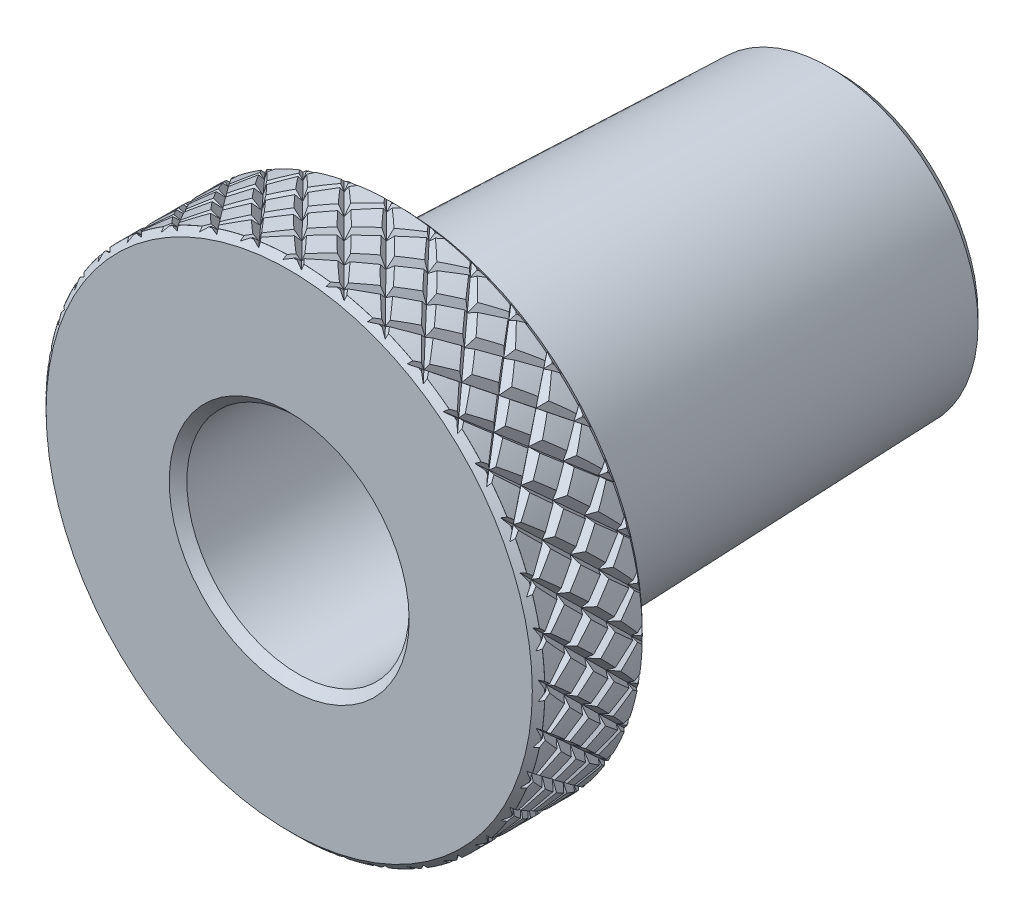
from build123d import *
from OCP.BRepFilletAPI import BRepFilletAPI_MakeChamfer

# Parameters (mm, degrees)
SKETCH1_R           = 4.282439997
BOSS_EXTRUDE1_DEPTH = 12.7
BOSS_EXTRUDE1_DRAFT = -2
SKETCH2_R           = 7.20725
BOSS_EXTRUDE2_DEPTH = 3.175
FILLET1_R           = 1.5875
SKETCH3_R           = 3.2131
CUT_EXTRUDE1_DEPTH  = 143.492079684
CIRPATTERN1_COUNT   = 36
CHAMFER2_SIZE       = 0.254
CHAMFER2_SIZE2      = 0.263351253


with BuildPart() as part:
    # Sketch1 → Boss-Extrude1 (with draft: the straight prism first)
    with BuildSketch(Plane.XY):
        with Locations((-72.0725, 110.124324555)):
            Circle(SKETCH1_R)
    extrude(amount=BOSS_EXTRUDE1_DEPTH)
    # Boss-Extrude1: the draft: its side faces are tilted about the plane it starts from
    boss_extrude1_sides = [part.faces().sort_by_distance(p)[0] for p in [
        (-76.354939997, 110.124324555, 6.35),
    ]]
    draft(boss_extrude1_sides, Plane.XY, BOSS_EXTRUDE1_DRAFT)

    # Sketch2 → Boss-Extrude2 (add)
    with BuildSketch(Plane.XY.offset(12.7)):
        with Locations((-72.0725, 110.124324555)):
            Circle(SKETCH2_R)
    extrude(amount=BOSS_EXTRUDE2_DEPTH)

    # Fillet1
    fillet1_edges = [part.edges().sort_by_distance(p)[0] for p in [
        (-76.798433769, 110.124324555, 12.7),
    ]]
    fillet(fillet1_edges, radius=FILLET1_R)

    # Sketch3 → Cut-Extrude1 (cut, through all)
    with BuildSketch(Plane.XY.offset(15.875)):
        with Locations((-72.0725, 110.124324555)):
            Circle(SKETCH3_R)
    extrude(amount=-CUT_EXTRUDE1_DEPTH, mode=Mode.SUBTRACT)

    # Cut-Sweep2: sweep along a path in Sketch4
    with BuildLine(Plane(origin=(-79.27975, 0, 0), x_dir=(0, 0, -1), z_dir=(1, 0, 0))) as cut_sweep2_path:
        Line((-17.387062992, 113.223887547), (-11.187937008, 107.024761563))
    # Sketch7 → Cut-Sweep2 (sweep, cut)
    with BuildSketch(Plane(origin=(-79.27975, 113.223887547, 17.387062992), x_dir=(-1, 0, 0), z_dir=(0, -0.7071067811865454, -0.7071067811865498))):
        Polygon((-0.254, 0), (0, -0.146646968), (0, 0.146646968), align=None)
    cut_sweep2 = sweep(path=cut_sweep2_path.line, mode=Mode.SUBTRACT)

    # CirPattern1: Cut-Sweep2 ×36 about axis
    cirpattern1_axis = Axis((-72.0725, 110.124324555, 15.875), (0, 0, -1))
    for i in range(1, CIRPATTERN1_COUNT):
        add(cut_sweep2.rotate(cirpattern1_axis, i * 360 / CIRPATTERN1_COUNT), mode=Mode.SUBTRACT)

    # Mirror1 copy 1: sweep along a path in Mirror1 copy 1 path
    with BuildLine(Plane(origin=(-45.851856046, 2.924561766, 0), x_dir=(0, 0, -1), z_dir=(-0.984807753012208, -0.17364817766693033, 0))) as mirror1_copy_1_path:
        Line((-17.387062992, -113.223887547), (-11.187937008, -107.024761563))
    # Mirror1 copy 1 sketch → Mirror1 copy 1 (sweep, cut)
    with BuildSketch(Plane(origin=(-65.512977787, 114.428324049, 17.387062992), x_dir=(0.984807753012208, 0.17364817766693033, 0), z_dir=(0.12278780396897246, -0.6963642403200168, -0.7071067811865498))):
        Polygon((-0.254, 0), (0, 0.146646968), (0, -0.146646968), align=None)
    sweep(path=mirror1_copy_1_path.line, mode=Mode.SUBTRACT)

    # Mirror1 copy 2: sweep along a path in Mirror1 copy 2 path
    with BuildLine(Plane(origin=(-27.635163091, 9.10633408, 0), x_dir=(0, 0, -1), z_dir=(-0.9396926207859084, -0.3420201433256687, 0))) as mirror1_copy_2_path:
        Line((-17.387062992, -113.223887547), (-11.187937008, -107.024761563))
    # Mirror1 copy 2 sketch → Mirror1 copy 2 (sweep, cut)
    with BuildSketch(Plane(origin=(-66.360013338, 115.501985704, 17.387062992), x_dir=(0.9396926207859084, 0.3420201433256687, 0), z_dir=(0.2418447626479745, -0.6644630243886727, -0.7071067811865498))):
        Polygon((-0.254, 0), (0, 0.146646968), (0, -0.146646968), align=None)
    sweep(path=mirror1_copy_2_path.line, mode=Mode.SUBTRACT)

    # Mirror1 copy 3: sweep along a path in Mirror1 copy 3 path
    with BuildLine(Plane(origin=(-10.768676131, 18.357486916, 0), x_dir=(0, 0, -1), z_dir=(-0.8660254037844387, -0.49999999999999994, 0))) as mirror1_copy_3_path:
        Line((-17.387062992, -113.223887547), (-11.187937008, -107.024761563))
    # Mirror1 copy 3 sketch → Mirror1 copy 3 (sweep, cut)
    with BuildSketch(Plane(origin=(-67.380619905, 116.412249847, 17.387062992), x_dir=(0.8660254037844387, 0.49999999999999994, 0), z_dir=(0.3535533905932726, -0.6123724356957927, -0.7071067811865498))):
        Polygon((-0.254, 0), (0, 0.146646968), (0, -0.146646968), align=None)
    sweep(path=mirror1_copy_3_path.line, mode=Mode.SUBTRACT)

    # Mirror1 copy 4: sweep along a path in Mirror1 copy 4 path
    with BuildLine(Plane(origin=(4.235125162, 30.396928677, 0), x_dir=(0, 0, -1), z_dir=(-0.766044443118978, -0.6427876096865393, 0))) as mirror1_copy_4_path:
        Line((-17.387062992, -113.223887547), (-11.187937008, -107.024761563))
    # Mirror1 copy 4 sketch → Mirror1 copy 4 (sweep, cut)
    with BuildSketch(Plane(origin=(-68.543786874, 117.131458561, 17.387062992), x_dir=(0.766044443118978, 0.6427876096865393, 0), z_dir=(0.4545194776720422, -0.5416752204197002, -0.7071067811865498))):
        Polygon((-0.254, 0), (0, 0.146646968), (0, -0.146646968), align=None)
    sweep(path=mirror1_copy_4_path.line, mode=Mode.SUBTRACT)

    # Mirror1 copy 5: sweep along a path in Mirror1 copy 5 path
    with BuildLine(Plane(origin=(16.920357878, 44.858847019, 0), x_dir=(0, 0, -1), z_dir=(-0.6427876096865394, -0.766044443118978, 0))) as mirror1_copy_5_path:
        Line((-17.387062992, -113.223887547), (-11.187937008, -107.024761563))
    # Mirror1 copy 5 sketch → Mirror1 copy 5 (sweep, cut)
    with BuildSketch(Plane(origin=(-69.814172006, 117.637759054, 17.387062992), x_dir=(0.6427876096865394, 0.766044443118978, 0), z_dir=(0.5416752204197002, -0.4545194776720423, -0.7071067811865498))):
        Polygon((-0.254, 0), (0, 0.146646968), (0, -0.146646968), align=None)
    sweep(path=mirror1_copy_5_path.line, mode=Mode.SUBTRACT)

    # Mirror1 copy 6: sweep along a path in Mirror1 copy 6 path
    with BuildLine(Plane(origin=(26.901587639, 61.303823869, 0), x_dir=(0, 0, -1), z_dir=(-0.5000000000000001, -0.8660254037844386, 0))) as mirror1_copy_6_path:
        Line((-17.387062992, -113.223887547), (-11.187937008, -107.024761563))
    # Mirror1 copy 6 sketch → Mirror1 copy 6 (sweep, cut)
    with BuildSketch(Plane(origin=(-71.153175292, 117.915767642, 17.387062992), x_dir=(0.5000000000000001, 0.8660254037844386, 0), z_dir=(0.6123724356957926, -0.35355339059327273, -0.7071067811865498))):
        Polygon((-0.254, 0), (0, 0.146646968), (0, -0.146646968), align=None)
    sweep(path=mirror1_copy_6_path.line, mode=Mode.SUBTRACT)

    # Mirror1 copy 7: sweep along a path in Mirror1 copy 7 path
    with BuildLine(Plane(origin=(33.875539831, 79.232186928, 0), x_dir=(0, 0, -1), z_dir=(-0.3420201433256688, -0.9396926207859083, 0))) as mirror1_copy_7_path:
        Line((-17.387062992, -113.223887547), (-11.187937008, -107.024761563))
    # Mirror1 copy 7 sketch → Mirror1 copy 7 (sweep, cut)
    with BuildSketch(Plane(origin=(-72.520111793, 117.957037175, 17.387062992), x_dir=(0.3420201433256688, 0.9396926207859083, 0), z_dir=(0.6644630243886727, -0.24184476264797458, -0.7071067811865498))):
        Polygon((-0.254, 0), (0, 0.146646968), (0, -0.146646968), align=None)
    sweep(path=mirror1_copy_7_path.line, mode=Mode.SUBTRACT)

    # Mirror1 copy 8: sweep along a path in Mirror1 copy 8 path
    with BuildLine(Plane(origin=(37.630314446, 98.099191957, 0), x_dir=(0, 0, -1), z_dir=(-0.17364817766693041, -0.984807753012208, 0))) as mirror1_copy_8_path:
        Line((-17.387062992, -113.223887547), (-11.187937008, -107.024761563))
    # Mirror1 copy 8 sketch → Mirror1 copy 8 (sweep, cut)
    with BuildSketch(Plane(origin=(-73.873447837, 117.760313698, 17.387062992), x_dir=(0.17364817766693041, 0.984807753012208, 0), z_dir=(0.6963642403200168, -0.12278780396897251, -0.7071067811865498))):
        Polygon((-0.254, 0), (0, 0.146646968), (0, -0.146646968), align=None)
    sweep(path=mirror1_copy_8_path.line, mode=Mode.SUBTRACT)

    # Mirror1 copy 9: sweep along a path in Mirror1 copy 9 path
    with BuildLine(Plane(origin=(38.051824555, 117.331574555, 0), x_dir=(0, 0, -1), z_dir=(0, -1, 0))) as mirror1_copy_9_path:
        Line((-17.387062992, -113.223887547), (-11.187937008, -107.024761563))
    # Mirror1 copy 9 sketch → Mirror1 copy 9 (sweep, cut)
    with BuildSketch(Plane(origin=(-75.172062992, 117.331574555, 17.387062992), x_dir=(0, 1, 0), z_dir=(0.7071067811865454, 0, -0.7071067811865498))):
        Polygon((-0.254, 0), (0, 0.146646968), (0, -0.146646968), align=None)
    sweep(path=mirror1_copy_9_path.line, mode=Mode.SUBTRACT)

    # Mirror1 copy 10: sweep along a path in Mirror1 copy 10 path
    with BuildLine(Plane(origin=(35.127262789, 136.344968509, 0), x_dir=(0, 0, -1), z_dir=(0.1736481776669303, -0.984807753012208, 0))) as mirror1_copy_10_path:
        Line((-17.387062992, -113.223887547), (-11.187937008, -107.024761563))
    # Mirror1 copy 10 sketch → Mirror1 copy 10 (sweep, cut)
    with BuildSketch(Plane(origin=(-76.376499494, 116.683846768, 17.387062992), x_dir=(-0.1736481776669303, 0.984807753012208, 0), z_dir=(0.6963642403200168, 0.12278780396897243, -0.7071067811865498))):
        Polygon((-0.254, 0), (0, 0.146646968), (0, -0.146646968), align=None)
    sweep(path=mirror1_copy_10_path.line, mode=Mode.SUBTRACT)

    # Mirror1 copy 11: sweep along a path in Mirror1 copy 11 path
    with BuildLine(Plane(origin=(28.945490475, 154.561661464, 0), x_dir=(0, 0, -1), z_dir=(0.3420201433256687, -0.9396926207859084, 0))) as mirror1_copy_11_path:
        Line((-17.387062992, -113.223887547), (-11.187937008, -107.024761563))
    # Mirror1 copy 11 sketch → Mirror1 copy 11 (sweep, cut)
    with BuildSketch(Plane(origin=(-77.450161149, 115.836811217, 17.387062992), x_dir=(-0.3420201433256687, 0.9396926207859084, 0), z_dir=(0.6644630243886727, 0.2418447626479745, -0.7071067811865498))):
        Polygon((-0.254, 0), (0, 0.146646968), (0, -0.146646968), align=None)
    sweep(path=mirror1_copy_11_path.line, mode=Mode.SUBTRACT)

    # Mirror1 copy 12: sweep along a path in Mirror1 copy 12 path
    with BuildLine(Plane(origin=(19.694337639, 171.428148424, 0), x_dir=(0, 0, -1), z_dir=(0.4999999999999998, -0.8660254037844387, 0))) as mirror1_copy_12_path:
        Line((-17.387062992, -113.223887547), (-11.187937008, -107.024761563))
    # Mirror1 copy 12 sketch → Mirror1 copy 12 (sweep, cut)
    with BuildSketch(Plane(origin=(-78.360425292, 114.816204651, 17.387062992), x_dir=(-0.4999999999999998, 0.8660254037844387, 0), z_dir=(0.6123724356957927, 0.3535533905932725, -0.7071067811865498))):
        Polygon((-0.254, 0), (0, 0.146646968), (0, -0.146646968), align=None)
    sweep(path=mirror1_copy_12_path.line, mode=Mode.SUBTRACT)

    # Mirror1 copy 13: sweep along a path in Mirror1 copy 13 path
    with BuildLine(Plane(origin=(7.654895878, 186.431949717, 0), x_dir=(0, 0, -1), z_dir=(0.6427876096865394, -0.766044443118978, 0))) as mirror1_copy_13_path:
        Line((-17.387062992, -113.223887547), (-11.187937008, -107.024761563))
    # Mirror1 copy 13 sketch → Mirror1 copy 13 (sweep, cut)
    with BuildSketch(Plane(origin=(-79.079634006, 113.653037681, 17.387062992), x_dir=(-0.6427876096865394, 0.766044443118978, 0), z_dir=(0.5416752204197002, 0.4545194776720423, -0.7071067811865497))):
        Polygon((-0.254, 0), (0, 0.146646968), (0, -0.146646968), align=None)
    sweep(path=mirror1_copy_13_path.line, mode=Mode.SUBTRACT)

    # Mirror1 copy 14: sweep along a path in Mirror1 copy 14 path
    with BuildLine(Plane(origin=(-6.807022464, 199.117182433, 0), x_dir=(0, 0, -1), z_dir=(0.7660444431189779, -0.6427876096865395, 0))) as mirror1_copy_14_path:
        Line((-17.387062992, -113.223887547), (-11.187937008, -107.024761563))
    # Mirror1 copy 14 sketch → Mirror1 copy 14 (sweep, cut)
    with BuildSketch(Plane(origin=(-79.585934499, 112.382652549, 17.387062992), x_dir=(-0.7660444431189779, 0.6427876096865395, 0), z_dir=(0.45451947767204237, 0.5416752204197001, -0.7071067811865498))):
        Polygon((-0.254, 0), (0, 0.146646968), (0, -0.146646968), align=None)
    sweep(path=mirror1_copy_14_path.line, mode=Mode.SUBTRACT)

    # Mirror1 copy 15: sweep along a path in Mirror1 copy 15 path
    with BuildLine(Plane(origin=(-23.251999314, 209.098412194, 0), x_dir=(0, 0, -1), z_dir=(0.8660254037844387, -0.49999999999999994, 0))) as mirror1_copy_15_path:
        Line((-17.387062992, -113.223887547), (-11.187937008, -107.024761563))
    # Mirror1 copy 15 sketch → Mirror1 copy 15 (sweep, cut)
    with BuildSketch(Plane(origin=(-79.863943087, 111.043649263, 17.387062992), x_dir=(-0.8660254037844387, 0.49999999999999994, 0), z_dir=(0.3535533905932726, 0.6123724356957927, -0.7071067811865498))):
        Polygon((-0.254, 0), (0, 0.146646968), (0, -0.146646968), align=None)
    sweep(path=mirror1_copy_15_path.line, mode=Mode.SUBTRACT)

    # Mirror1 copy 16: sweep along a path in Mirror1 copy 16 path
    with BuildLine(Plane(origin=(-41.180362373, 216.072364386, 0), x_dir=(0, 0, -1), z_dir=(0.9396926207859083, -0.3420201433256689, 0))) as mirror1_copy_16_path:
        Line((-17.387062992, -113.223887547), (-11.187937008, -107.024761563))
    # Mirror1 copy 16 sketch → Mirror1 copy 16 (sweep, cut)
    with BuildSketch(Plane(origin=(-79.90521262, 109.676712762, 17.387062992), x_dir=(-0.9396926207859083, 0.3420201433256689, 0), z_dir=(0.24184476264797464, 0.6644630243886727, -0.7071067811865498))):
        Polygon((-0.254, 0), (0, 0.146646968), (0, -0.146646968), align=None)
    sweep(path=mirror1_copy_16_path.line, mode=Mode.SUBTRACT)

    # Mirror1 copy 17: sweep along a path in Mirror1 copy 17 path
    with BuildLine(Plane(origin=(-60.047367402, 219.827139001, 0), x_dir=(0, 0, -1), z_dir=(0.984807753012208, -0.17364817766693028, 0))) as mirror1_copy_17_path:
        Line((-17.387062992, -113.223887547), (-11.187937008, -107.024761563))
    # Mirror1 copy 17 sketch → Mirror1 copy 17 (sweep, cut)
    with BuildSketch(Plane(origin=(-79.708489143, 108.323376718, 17.387062992), x_dir=(-0.984807753012208, 0.17364817766693028, 0), z_dir=(0.12278780396897242, 0.6963642403200168, -0.7071067811865498))):
        Polygon((-0.254, 0), (0, 0.146646968), (0, -0.146646968), align=None)
    sweep(path=mirror1_copy_17_path.line, mode=Mode.SUBTRACT)

    # Mirror1 copy 18: sweep along a path in Mirror1 copy 18 path
    with BuildLine(Plane(origin=(-79.27975, 220.24864911, 0), x_dir=(0, 0, -1), z_dir=(1, 0, 0))) as mirror1_copy_18_path:
        Line((-17.387062992, -113.223887547), (-11.187937008, -107.024761563))
    # Mirror1 copy 18 sketch → Mirror1 copy 18 (sweep, cut)
    with BuildSketch(Plane(origin=(-79.27975, 107.024761563, 17.387062992), x_dir=(-1, 0, 0), z_dir=(0, 0.7071067811865454, -0.7071067811865498))):
        Polygon((-0.254, 0), (0, 0.146646968), (0, -0.146646968), align=None)
    sweep(path=mirror1_copy_18_path.line, mode=Mode.SUBTRACT)

    # Mirror1 copy 19: sweep along a path in Mirror1 copy 19 path
    with BuildLine(Plane(origin=(-98.293143954, 217.324087344, 0), x_dir=(0, 0, -1), z_dir=(0.984807753012208, 0.17364817766693047, 0))) as mirror1_copy_19_path:
        Line((-17.387062992, -113.223887547), (-11.187937008, -107.024761563))
    # Mirror1 copy 19 sketch → Mirror1 copy 19 (sweep, cut)
    with BuildSketch(Plane(origin=(-78.632022213, 105.820325061, 17.387062992), x_dir=(-0.984807753012208, -0.17364817766693047, 0), z_dir=(-0.12278780396897256, 0.6963642403200168, -0.7071067811865498))):
        Polygon((-0.254, 0), (0, 0.146646968), (0, -0.146646968), align=None)
    sweep(path=mirror1_copy_19_path.line, mode=Mode.SUBTRACT)

    # Mirror1 copy 20: sweep along a path in Mirror1 copy 20 path
    with BuildLine(Plane(origin=(-116.509836909, 211.14231503, 0), x_dir=(0, 0, -1), z_dir=(0.9396926207859084, 0.34202014332566866, 0))) as mirror1_copy_20_path:
        Line((-17.387062992, -113.223887547), (-11.187937008, -107.024761563))
    # Mirror1 copy 20 sketch → Mirror1 copy 20 (sweep, cut)
    with BuildSketch(Plane(origin=(-77.784986662, 104.746663406, 17.387062992), x_dir=(-0.9396926207859084, -0.34202014332566866, 0), z_dir=(-0.24184476264797447, 0.6644630243886727, -0.7071067811865498))):
        Polygon((-0.254, 0), (0, 0.146646968), (0, -0.146646968), align=None)
    sweep(path=mirror1_copy_20_path.line, mode=Mode.SUBTRACT)

    # Mirror1 copy 21: sweep along a path in Mirror1 copy 21 path
    with BuildLine(Plane(origin=(-133.376323869, 201.891162194, 0), x_dir=(0, 0, -1), z_dir=(0.8660254037844386, 0.5000000000000001, 0))) as mirror1_copy_21_path:
        Line((-17.387062992, -113.223887547), (-11.187937008, -107.024761563))
    # Mirror1 copy 21 sketch → Mirror1 copy 21 (sweep, cut)
    with BuildSketch(Plane(origin=(-76.764380095, 103.836399263, 17.387062992), x_dir=(-0.8660254037844386, -0.5000000000000001, 0), z_dir=(-0.35355339059327273, 0.6123724356957926, -0.7071067811865498))):
        Polygon((-0.254, 0), (0, 0.146646968), (0, -0.146646968), align=None)
    sweep(path=mirror1_copy_21_path.line, mode=Mode.SUBTRACT)

    # Mirror1 copy 22: sweep along a path in Mirror1 copy 22 path
    with BuildLine(Plane(origin=(-148.380125162, 189.851720433, 0), x_dir=(0, 0, -1), z_dir=(0.766044443118978, 0.6427876096865393, 0))) as mirror1_copy_22_path:
        Line((-17.387062992, -113.223887547), (-11.187937008, -107.024761563))
    # Mirror1 copy 22 sketch → Mirror1 copy 22 (sweep, cut)
    with BuildSketch(Plane(origin=(-75.601213126, 103.117190549, 17.387062992), x_dir=(-0.766044443118978, -0.6427876096865393, 0), z_dir=(-0.4545194776720422, 0.5416752204197002, -0.7071067811865497))):
        Polygon((-0.254, 0), (0, 0.146646968), (0, -0.146646968), align=None)
    sweep(path=mirror1_copy_22_path.line, mode=Mode.SUBTRACT)

    # Mirror1 copy 23: sweep along a path in Mirror1 copy 23 path
    with BuildLine(Plane(origin=(-161.065357878, 175.389802091, 0), x_dir=(0, 0, -1), z_dir=(0.6427876096865395, 0.7660444431189779, 0))) as mirror1_copy_23_path:
        Line((-17.387062992, -113.223887547), (-11.187937008, -107.024761563))
    # Mirror1 copy 23 sketch → Mirror1 copy 23 (sweep, cut)
    with BuildSketch(Plane(origin=(-74.330827994, 102.610890056, 17.387062992), x_dir=(-0.6427876096865395, -0.7660444431189779, 0), z_dir=(-0.5416752204197001, 0.45451947767204237, -0.7071067811865498))):
        Polygon((-0.254, 0), (0, 0.146646968), (0, -0.146646968), align=None)
    sweep(path=mirror1_copy_23_path.line, mode=Mode.SUBTRACT)

    # Mirror1 copy 24: sweep along a path in Mirror1 copy 24 path
    with BuildLine(Plane(origin=(-171.046587639, 158.944825241, 0), x_dir=(0, 0, -1), z_dir=(0.5000000000000004, 0.8660254037844384, 0))) as mirror1_copy_24_path:
        Line((-17.387062992, -113.223887547), (-11.187937008, -107.024761563))
    # Mirror1 copy 24 sketch → Mirror1 copy 24 (sweep, cut)
    with BuildSketch(Plane(origin=(-72.991824708, 102.332881468, 17.387062992), x_dir=(-0.5000000000000004, -0.8660254037844384, 0), z_dir=(-0.6123724356957925, 0.353553390593273, -0.7071067811865498))):
        Polygon((-0.254, 0), (0, 0.146646968), (0, -0.146646968), align=None)
    sweep(path=mirror1_copy_24_path.line, mode=Mode.SUBTRACT)

    # Mirror1 copy 25: sweep along a path in Mirror1 copy 25 path
    with BuildLine(Plane(origin=(-178.020539831, 141.016462182, 0), x_dir=(0, 0, -1), z_dir=(0.34202014332566855, 0.9396926207859084, 0))) as mirror1_copy_25_path:
        Line((-17.387062992, -113.223887547), (-11.187937008, -107.024761563))
    # Mirror1 copy 25 sketch → Mirror1 copy 25 (sweep, cut)
    with BuildSketch(Plane(origin=(-71.624888207, 102.291611935, 17.387062992), x_dir=(-0.34202014332566855, -0.9396926207859084, 0), z_dir=(-0.6644630243886727, 0.2418447626479744, -0.7071067811865497))):
        Polygon((-0.254, 0), (0, 0.146646968), (0, -0.146646968), align=None)
    sweep(path=mirror1_copy_25_path.line, mode=Mode.SUBTRACT)

    # Mirror1 copy 26: sweep along a path in Mirror1 copy 26 path
    with BuildLine(Plane(origin=(-181.775314446, 122.149457153, 0), x_dir=(0, 0, -1), z_dir=(0.17364817766693033, 0.984807753012208, 0))) as mirror1_copy_26_path:
        Line((-17.387062992, -113.223887547), (-11.187937008, -107.024761563))
    # Mirror1 copy 26 sketch → Mirror1 copy 26 (sweep, cut)
    with BuildSketch(Plane(origin=(-70.271552163, 102.488335412, 17.387062992), x_dir=(-0.17364817766693033, -0.984807753012208, 0), z_dir=(-0.6963642403200168, 0.12278780396897246, -0.7071067811865498))):
        Polygon((-0.254, 0), (0, 0.146646968), (0, -0.146646968), align=None)
    sweep(path=mirror1_copy_26_path.line, mode=Mode.SUBTRACT)

    # Mirror1 copy 27: sweep along a path in Mirror1 copy 27 path
    with BuildLine(Plane(origin=(-182.196824555, 102.917074555, 0), x_dir=(0, 0, -1), z_dir=(0, 1, 0))) as mirror1_copy_27_path:
        Line((-17.387062992, -113.223887547), (-11.187937008, -107.024761563))
    # Mirror1 copy 27 sketch → Mirror1 copy 27 (sweep, cut)
    with BuildSketch(Plane(origin=(-68.972937008, 102.917074555, 17.387062992), x_dir=(0, -1, 0), z_dir=(-0.7071067811865454, 0, -0.7071067811865498))):
        Polygon((-0.254, 0), (0, 0.146646968), (0, -0.146646968), align=None)
    sweep(path=mirror1_copy_27_path.line, mode=Mode.SUBTRACT)

    # Mirror1 copy 28: sweep along a path in Mirror1 copy 28 path
    with BuildLine(Plane(origin=(-179.272262789, 83.903680601, 0), x_dir=(0, 0, -1), z_dir=(-0.17364817766692997, 0.9848077530122081, 0))) as mirror1_copy_28_path:
        Line((-17.387062992, -113.223887547), (-11.187937008, -107.024761563))
    # Mirror1 copy 28 sketch → Mirror1 copy 28 (sweep, cut)
    with BuildSketch(Plane(origin=(-67.768500506, 103.564802342, 17.387062992), x_dir=(0.17364817766692997, -0.9848077530122081, 0), z_dir=(-0.6963642403200169, -0.1227878039689722, -0.7071067811865498))):
        Polygon((-0.254, 0), (0, 0.146646968), (0, -0.146646968), align=None)
    sweep(path=mirror1_copy_28_path.line, mode=Mode.SUBTRACT)

    # Mirror1 copy 29: sweep along a path in Mirror1 copy 29 path
    with BuildLine(Plane(origin=(-173.090490475, 65.686987646, 0), x_dir=(0, 0, -1), z_dir=(-0.342020143325669, 0.9396926207859083, 0))) as mirror1_copy_29_path:
        Line((-17.387062992, -113.223887547), (-11.187937008, -107.024761563))
    # Mirror1 copy 29 sketch → Mirror1 copy 29 (sweep, cut)
    with BuildSketch(Plane(origin=(-66.694838851, 104.411837893, 17.387062992), x_dir=(0.342020143325669, -0.9396926207859083, 0), z_dir=(-0.6644630243886727, -0.2418447626479747, -0.7071067811865498))):
        Polygon((-0.254, 0), (0, 0.146646968), (0, -0.146646968), align=None)
    sweep(path=mirror1_copy_29_path.line, mode=Mode.SUBTRACT)

    # Mirror1 copy 30: sweep along a path in Mirror1 copy 30 path
    with BuildLine(Plane(origin=(-163.839337639, 48.820500686, 0), x_dir=(0, 0, -1), z_dir=(-0.5000000000000001, 0.8660254037844386, 0))) as mirror1_copy_30_path:
        Line((-17.387062992, -113.223887547), (-11.187937008, -107.024761563))
    # Mirror1 copy 30 sketch → Mirror1 copy 30 (sweep, cut)
    with BuildSketch(Plane(origin=(-65.784574708, 105.43244446, 17.387062992), x_dir=(0.5000000000000001, -0.8660254037844386, 0), z_dir=(-0.6123724356957926, -0.35355339059327273, -0.7071067811865498))):
        Polygon((-0.254, 0), (0, 0.146646968), (0, -0.146646968), align=None)
    sweep(path=mirror1_copy_30_path.line, mode=Mode.SUBTRACT)

    # Mirror1 copy 31: sweep along a path in Mirror1 copy 31 path
    with BuildLine(Plane(origin=(-151.799895878, 33.816699393, 0), x_dir=(0, 0, -1), z_dir=(-0.6427876096865393, 0.7660444431189781, 0))) as mirror1_copy_31_path:
        Line((-17.387062992, -113.223887547), (-11.187937008, -107.024761563))
    # Mirror1 copy 31 sketch → Mirror1 copy 31 (sweep, cut)
    with BuildSketch(Plane(origin=(-65.065365994, 106.595611429, 17.387062992), x_dir=(0.6427876096865393, -0.7660444431189781, 0), z_dir=(-0.5416752204197003, -0.4545194776720422, -0.7071067811865498))):
        Polygon((-0.254, 0), (0, 0.146646968), (0, -0.146646968), align=None)
    sweep(path=mirror1_copy_31_path.line, mode=Mode.SUBTRACT)

    # Mirror1 copy 32: sweep along a path in Mirror1 copy 32 path
    with BuildLine(Plane(origin=(-137.337977536, 21.131466678, 0), x_dir=(0, 0, -1), z_dir=(-0.7660444431189778, 0.6427876096865396, 0))) as mirror1_copy_32_path:
        Line((-17.387062992, -113.223887547), (-11.187937008, -107.024761563))
    # Mirror1 copy 32 sketch → Mirror1 copy 32 (sweep, cut)
    with BuildSketch(Plane(origin=(-64.559065501, 107.865996561, 17.387062992), x_dir=(0.7660444431189778, -0.6427876096865396, 0), z_dir=(-0.4545194776720425, -0.5416752204197001, -0.7071067811865498))):
        Polygon((-0.254, 0), (0, 0.146646968), (0, -0.146646968), align=None)
    sweep(path=mirror1_copy_32_path.line, mode=Mode.SUBTRACT)

    # Mirror1 copy 33: sweep along a path in Mirror1 copy 33 path
    with BuildLine(Plane(origin=(-120.893000686, 11.150236916, 0), x_dir=(0, 0, -1), z_dir=(-0.8660254037844384, 0.5000000000000004, 0))) as mirror1_copy_33_path:
        Line((-17.387062992, -113.223887547), (-11.187937008, -107.024761563))
    # Mirror1 copy 33 sketch → Mirror1 copy 33 (sweep, cut)
    with BuildSketch(Plane(origin=(-64.281056913, 109.204999847, 17.387062992), x_dir=(0.8660254037844384, -0.5000000000000004, 0), z_dir=(-0.353553390593273, -0.6123724356957925, -0.7071067811865498))):
        Polygon((-0.254, 0), (0, 0.146646968), (0, -0.146646968), align=None)
    sweep(path=mirror1_copy_33_path.line, mode=Mode.SUBTRACT)

    # Mirror1 copy 34: sweep along a path in Mirror1 copy 34 path
    with BuildLine(Plane(origin=(-102.964637627, 4.176284724, 0), x_dir=(0, 0, -1), z_dir=(-0.9396926207859084, 0.3420201433256686, 0))) as mirror1_copy_34_path:
        Line((-17.387062992, -113.223887547), (-11.187937008, -107.024761563))
    # Mirror1 copy 34 sketch → Mirror1 copy 34 (sweep, cut)
    with BuildSketch(Plane(origin=(-64.23978738, 110.571936348, 17.387062992), x_dir=(0.9396926207859084, -0.3420201433256686, 0), z_dir=(-0.24184476264797442, -0.6644630243886727, -0.7071067811865498))):
        Polygon((-0.254, 0), (0, 0.146646968), (0, -0.146646968), align=None)
    sweep(path=mirror1_copy_34_path.line, mode=Mode.SUBTRACT)

    # Mirror1 copy 35: sweep along a path in Mirror1 copy 35 path
    with BuildLine(Plane(origin=(-84.097632598, 0.42151011, 0), x_dir=(0, 0, -1), z_dir=(-0.984807753012208, 0.1736481776669304, 0))) as mirror1_copy_35_path:
        Line((-17.387062992, -113.223887547), (-11.187937008, -107.024761563))
    # Mirror1 copy 35 sketch → Mirror1 copy 35 (sweep, cut)
    with BuildSketch(Plane(origin=(-64.436510857, 111.925272392, 17.387062992), x_dir=(0.984807753012208, -0.1736481776669304, 0), z_dir=(-0.1227878039689725, -0.6963642403200168, -0.7071067811865498))):
        Polygon((-0.254, 0), (0, 0.146646968), (0, -0.146646968), align=None)
    sweep(path=mirror1_copy_35_path.line, mode=Mode.SUBTRACT)

    # Mirror1 copy 36: sweep along a path in Mirror1 copy 36 path
    with BuildLine(Plane(origin=(-64.86525, 0, 0), x_dir=(0, 0, -1), z_dir=(-1, 0, 0))) as mirror1_copy_36_path:
        Line((-17.387062992, -113.223887547), (-11.187937008, -107.024761563))
    # Mirror1 copy 36 sketch → Mirror1 copy 36 (sweep, cut)
    with BuildSketch(Plane(origin=(-64.86525, 113.223887547, 17.387062992), x_dir=(1, 0, 0), z_dir=(0, -0.7071067811865454, -0.7071067811865498))):
        Polygon((-0.254, 0), (0, 0.146646968), (0, -0.146646968), align=None)
    sweep(path=mirror1_copy_36_path.line, mode=Mode.SUBTRACT)

    # Sketch8 → Cut-Revolve1 (revolve, cut)
    with BuildSketch(Plane(origin=(-72.0725, 0, 0), x_dir=(0, 0, -1), z_dir=(1, 0, 0))):
        Polygon((-15.875, 117.149306284), (-15.695154304, 117.32867051), (-15.695154304, 117.36062035), (-16.002, 117.36062035), (-16.002, 117.149306284), align=None)
        Polygon((-12.573, 117.149306284), (-12.7, 117.149306284), (-12.879845696, 117.32867051), (-12.879845696, 117.36062035), (-12.573, 117.36062035), align=None)
    revolve(axis=Axis((-72.0725, 110.124324555, 0), (0, 0, 1)), mode=Mode.SUBTRACT)

    # Chamfer2: one chamfer whose edges measure the first distance from different faces: ONE call of the kernel's chamfer builder (chamfer() names one face for all edges)
    chamfer2_edges_1 = [part.edges().sort_by_distance(p)[0] for p in [
        (-75.2856, 110.124324555, 0),
        (-75.2856, 110.124324555, 15.875),
    ]]
    chamfer2_edges_2 = [part.edges().sort_by_distance(p)[0] for p in [
        (-76.354939997, 110.124324555, 0),
    ]]
    chamfer2_side_2 = [part.faces().sort_by_distance(p)[0] for p in [
        (-76.233814302, 110.124324555, 0),
    ]]
    chamfer2 = BRepFilletAPI_MakeChamfer(part.part.solid().wrapped)
    for e in chamfer2_edges_1:
        chamfer2.Add(CHAMFER2_SIZE, e.wrapped)
    for e in chamfer2_edges_2:
        chamfer2.Add(CHAMFER2_SIZE, CHAMFER2_SIZE2, e.wrapped, chamfer2_side_2[0].wrapped)  # the first distance lies on this face
    add(Compound.cast(chamfer2.Shape()), mode=Mode.REPLACE)


solid = part.part
